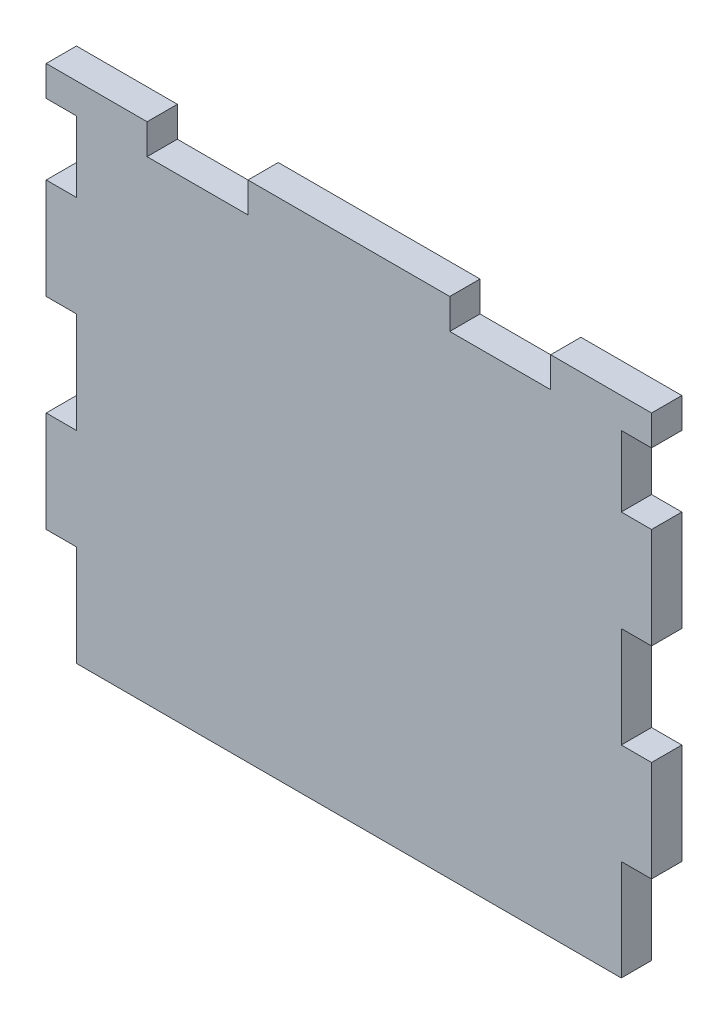
from build123d import *

# Parameters (mm, degrees)
SKETCH1_W             = 60
SKETCH1_H             = 50
BOSS_EXTRUDE1_DEPTH   = 3
SKETCH2_W             = 10
SKETCH2_H             = 3
CUT_EXTRUDE1_DEPTH    = 3
CAVITY3_START         = -30
CAVITY3_OUTLINE_W     = 7
CAVITY3_OUTLINE_H     = 3
CAVITY3_OUTLINE_W_2   = 10
CAVITY3_DEPTH         = 3
CAVITY3_START_2       = 27
CAVITY3_2_OUTLINE_W   = 7
CAVITY3_2_OUTLINE_H   = 3
CAVITY3_2_OUTLINE_W_2 = 10
CAVITY3_2_DEPTH       = 3


# Read off the part's stored shape, not the designer's step: Cavity3
with BuildPart() as part:
    # Sketch1 → Boss-Extrude1 (new body)
    with BuildSketch(Plane.XY):
        Rectangle(SKETCH1_W, SKETCH1_H)
    extrude(amount=BOSS_EXTRUDE1_DEPTH)

    # Sketch2 → Cut-Extrude1 (cut)
    with BuildSketch(Plane.XY.offset(3)):
        with Locations((-15, 23.5)):
            Rectangle(SKETCH2_W, SKETCH2_H)
        with Locations((15, 23.5)):
            Rectangle(SKETCH2_W, SKETCH2_H)
    extrude(amount=-CUT_EXTRUDE1_DEPTH, mode=Mode.SUBTRACT)

    # Cavity3 outline → Cavity3 (cut)
    with BuildSketch(Plane.YZ.offset(CAVITY3_START)):
        with Locations((18.5, 1.5)):
            Rectangle(CAVITY3_OUTLINE_W, CAVITY3_OUTLINE_H)
        with Locations((0, 1.5)):
            Rectangle(CAVITY3_OUTLINE_W_2, CAVITY3_OUTLINE_H)
        with Locations((-20, 1.5)):
            Rectangle(CAVITY3_OUTLINE_W_2, CAVITY3_OUTLINE_H)
    extrude(amount=CAVITY3_DEPTH, mode=Mode.SUBTRACT)

    # Cavity3 2 outline → Cavity3 2 (cut)
    with BuildSketch(Plane.YZ.offset(CAVITY3_START_2)):
        with Locations((18.5, 1.5)):
            Rectangle(CAVITY3_2_OUTLINE_W, CAVITY3_2_OUTLINE_H)
        with Locations((0, 1.5)):
            Rectangle(CAVITY3_2_OUTLINE_W_2, CAVITY3_2_OUTLINE_H)
        with Locations((-20, 1.5)):
            Rectangle(CAVITY3_2_OUTLINE_W_2, CAVITY3_2_OUTLINE_H)
    extrude(amount=CAVITY3_2_DEPTH, mode=Mode.SUBTRACT)


solid = part.part
